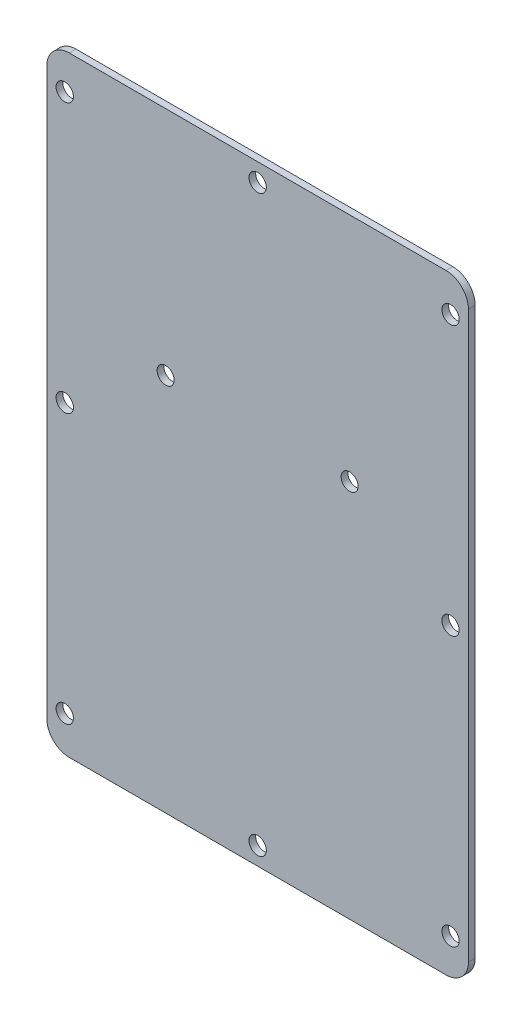
from build123d import *

# Parameters (mm, degrees)
SKETCH1_W                 = 94
SKETCH1_H                 = 136
BOSS_EXTRUDE1_DEPTH       = 1.5
FILLET1_R                 = 5
SKETCH_PATTERN1_OUTLINE_R = 1.9304
SKETCH_PATTERN1_DEPTH     = 1.5
SKETCH4_R                 = 1.8985
CUT_EXTRUDE1_DEPTH        = 137.364401513


# Read off the part's stored shape, not the designer's step: Sketch-Pattern1
with BuildPart() as part:
    # Sketch1 → Boss-Extrude1 (new body)
    with BuildSketch(Plane.XY):
        with Locations((0, 60)):
            Rectangle(SKETCH1_W, SKETCH1_H)
    extrude(amount=BOSS_EXTRUDE1_DEPTH)

    # Fillet1
    fillet1_edges = [part.edges().sort_by_distance(p)[0] for p in [
        (47, -8, 0.75),
        (-47, -8, 0.75),
        (-47, 128, 0.75),
        (47, 128, 0.75),
    ]]
    fillet(fillet1_edges, radius=FILLET1_R)

    # Sketch3 → #24 (0.152) Diameter Hole1 (revolve, cut)
    with BuildSketch(Plane(origin=(43, 0, 1.5), x_dir=(0, -1, 0), z_dir=(1, 0, 0))):
        Polygon((0, 0), (0, 13.859901339), (1.9304, 12.7), (1.9304, 0), align=None)
    revolve(axis=Axis((43, 0, 7.85), (0, 0, -1)), mode=Mode.SUBTRACT)

    # Sketch-Pattern1 outline → Sketch-Pattern1 (cut)
    with BuildSketch(Plane.XY):
        with Locations((0, -4)):
            Circle(SKETCH_PATTERN1_OUTLINE_R)
        with Locations((0, 124)):
            Circle(SKETCH_PATTERN1_OUTLINE_R)
        with Locations((43, 120)):
            Circle(SKETCH_PATTERN1_OUTLINE_R)
        with Locations((43, 60)):
            Circle(SKETCH_PATTERN1_OUTLINE_R)
        with Locations((-43, 120)):
            Circle(SKETCH_PATTERN1_OUTLINE_R)
        with Locations((-43, 60)):
            Circle(SKETCH_PATTERN1_OUTLINE_R)
        with Locations((-43, 0)):
            Circle(SKETCH_PATTERN1_OUTLINE_R)
    extrude(amount=SKETCH_PATTERN1_DEPTH, mode=Mode.SUBTRACT)

    # Sketch4 → Cut-Extrude1 (cut, through all)
    with BuildSketch(Plane(origin=(0, 0, 0), x_dir=(-1, 0, 0), z_dir=(0, 0, -1))):
        with Locations((20.500102944, 76.500016768)):
            Circle(SKETCH4_R)
        with Locations((-20.500312859, 76.499889767)):
            Circle(SKETCH4_R)
    extrude(amount=-CUT_EXTRUDE1_DEPTH, mode=Mode.SUBTRACT)


solid = part.part
